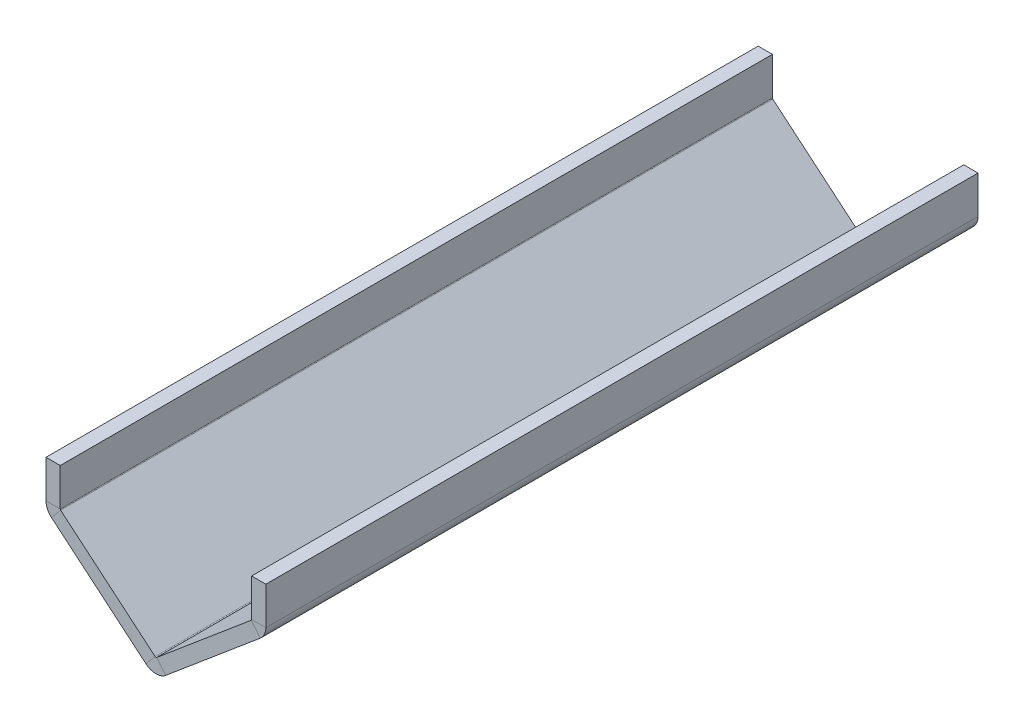
from build123d import *

# Parameters (mm, degrees)
BASE_FLANGE1_DEPTH = 300


# Sheet-metal steps are written as plain solids
with BuildPart() as part:
    # Sketch2 → Base-Flange1 (new body)
    with BuildSketch(Plane.XY):
        with BuildLine():
            Line((46.30399401, 57.832743539), (46.30399401, 41.960172265))
            ThreePointArc((46.30399401, 41.960172265), (45.696376381, 39.216118696), (43.987123244, 36.98509138))
            Line((43.987123244, 36.98509138), (4.183129234, 3.517243356))
            ThreePointArc((4.183129234, 3.517243356), (0, 1.992324241), (-4.183129234, 3.517243356))
            Line((-4.183129234, 3.517243356), (-43.987123244, 36.98509138))
            ThreePointArc((-43.987123244, 36.98509138), (-45.696376381, 39.216118696), (-46.30399401, 41.960172265))
            Line((-46.30399401, 41.960172265), (-46.30399401, 57.832743539))
            Line((-46.30399401, 57.832743539), (-40.30399401, 57.832743539))
            Line((-40.30399401, 57.832743539), (-40.30399401, 41.960172265))
            ThreePointArc((-40.30399401, 41.960172265), (-40.257254192, 41.749091222), (-40.125773182, 41.577473736))
            Line((-40.125773182, 41.577473736), (-0.321779172, 8.109625711))
            ThreePointArc((-0.321779172, 8.109625711), (0, 7.992324241), (0.321779172, 8.109625711))
            Line((0.321779172, 8.109625711), (40.125773182, 41.577473736))
            ThreePointArc((40.125773182, 41.577473736), (40.257254192, 41.749091222), (40.30399401, 41.960172265))
            Line((40.30399401, 41.960172265), (40.30399401, 57.832743539))
            Line((40.30399401, 57.832743539), (46.30399401, 57.832743539))
        make_face()
    extrude(amount=BASE_FLANGE1_DEPTH)


solid = part.part
